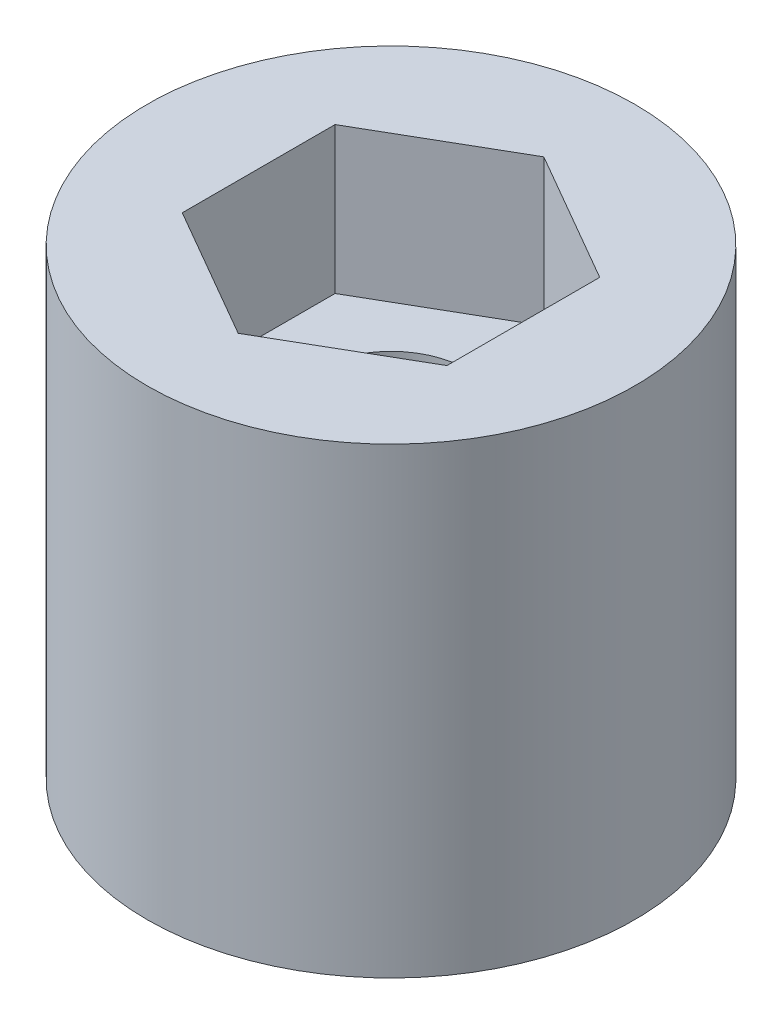
from build123d import *

# Parameters (mm, degrees)
SKETCH1_R           = 5
SKETCH1_R_2         = 1.575
BOSS_EXTRUDE1_DEPTH = 9.48
CUT_EXTRUDE1_START  = -3
SKETCH2_R           = 1.575
CUT_EXTRUDE1_DEPTH  = 3


with BuildPart() as part:
    # Sketch1 → Boss-Extrude1 (new body)
    with BuildSketch(Plane(origin=(0, 0, 0), x_dir=(1, 0, 0), z_dir=(0, 1, 0))):
        Circle(SKETCH1_R)
        Circle(SKETCH1_R_2, mode=Mode.SUBTRACT)
    extrude(amount=BOSS_EXTRUDE1_DEPTH)

    # Sketch2 → Cut-Extrude1 (cut)
    with BuildSketch(Plane(origin=(0, 9.48, 0), x_dir=(1, 0, 0), z_dir=(0, 1, 0)).offset(CUT_EXTRUDE1_START)):
        Polygon((2.7135, 1.566639955), (0, 3.133279911), (-2.7135, 1.566639955), (-2.7135, -1.566639955), (0, -3.133279911), (2.7135, -1.566639955), align=None)
        Circle(SKETCH2_R, mode=Mode.SUBTRACT)
    extrude(amount=CUT_EXTRUDE1_DEPTH, mode=Mode.SUBTRACT)


solid = part.part
